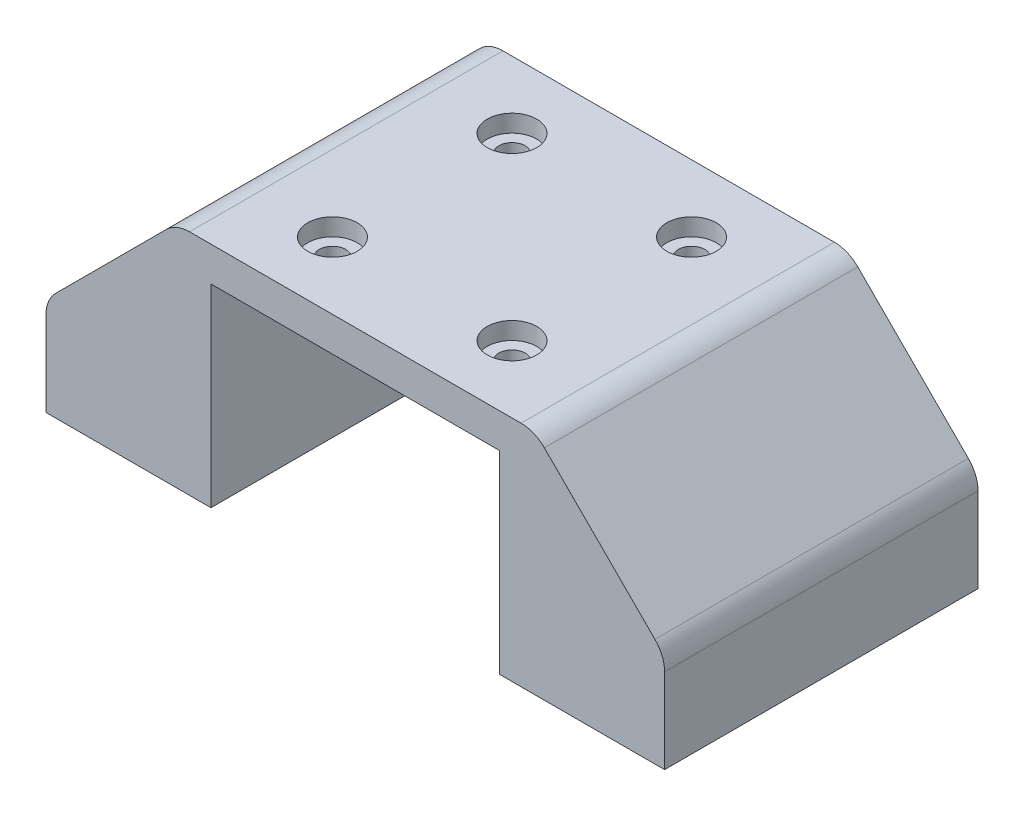
from build123d import *

# Parameters (mm, degrees)
BOSS_EXTRUDE1_DEPTH = 24.13
CHAMFER1_SIZE       = 10
FILLET1_R           = 2.54
FILLET2_R           = 2.54
SKETCH2_R           = 2.032
CUT_EXTRUDE1_DEPTH  = 10.16
SKETCH3_R           = 1.016
CUT_EXTRUDE2_DEPTH  = 39.185845946
SKETCH4_R           = 1.905
CUT_EXTRUDE3_DEPTH  = 1.3335


with BuildPart() as part:
    # Sketch1 → Boss-Extrude1 (new body)
    with BuildSketch(Plane.XY):
        Polygon((-11.1125, 0), (-11.1125, 14.9225), (11.1125, 14.9225), (11.1125, 0), (23.8125, 0), (23.8125, 17.574605951), (-23.8125, 17.574605951), (-23.8125, 0), align=None)
    extrude(amount=BOSS_EXTRUDE1_DEPTH)

    # Chamfer1
    chamfer1_edges = [part.edges().sort_by_distance(p)[0] for p in [
        (23.8125, 17.574605951, 12.065),
        (-23.8125, 17.574605951, 12.065),
    ]]
    chamfer(chamfer1_edges, length=CHAMFER1_SIZE)

    # Fillet1
    fillet1_edges = [part.edges().sort_by_distance(p)[0] for p in [
        (13.8125, 17.574605951, 12.065),
        (-13.8125, 17.574605951, 12.065),
    ]]
    fillet(fillet1_edges, radius=FILLET1_R)

    # Fillet2
    fillet2_edges = [part.edges().sort_by_distance(p)[0] for p in [
        (23.8125, 7.574605951, 12.065),
        (-23.8125, 7.574605951, 12.065),
    ]]
    fillet(fillet2_edges, radius=FILLET2_R)

    # Sketch2 → Cut-Extrude1 (cut)
    with BuildSketch(Plane.XZ):
        with Locations((-19.05, 19.685)):
            Circle(SKETCH2_R)
        with Locations((19.05, 19.685)):
            Circle(SKETCH2_R)
        with Locations((19.05, 4.445)):
            Circle(SKETCH2_R)
        with Locations((-19.05, 4.445)):
            Circle(SKETCH2_R)
    extrude(amount=-CUT_EXTRUDE1_DEPTH, mode=Mode.SUBTRACT)

    # Sketch3 → Cut-Extrude2 (cut, through all)
    with BuildSketch(Plane(origin=(0, 17.574605951, 0), x_dir=(1, 0, 0), z_dir=(0, 1, 0))):
        with Locations((-6.91134, -5.15366)):
            Circle(SKETCH3_R)
        with Locations((6.91134, -5.15366)):
            Circle(SKETCH3_R)
        with Locations((6.91134, -18.97634)):
            Circle(SKETCH3_R)
        with Locations((-6.91134, -18.97634)):
            Circle(SKETCH3_R)
    extrude(amount=-CUT_EXTRUDE2_DEPTH, mode=Mode.SUBTRACT)

    # Sketch4 → Cut-Extrude3 (cut)
    with BuildSketch(Plane(origin=(0, 17.574605951, 0), x_dir=(1, 0, 0), z_dir=(0, 1, 0))):
        with Locations((-6.91134, -5.15366)):
            Circle(SKETCH4_R)
        with Locations((6.91134, -5.15366)):
            Circle(SKETCH4_R)
        with Locations((6.91134, -18.97634)):
            Circle(SKETCH4_R)
        with Locations((-6.91134, -18.97634)):
            Circle(SKETCH4_R)
    extrude(amount=-CUT_EXTRUDE3_DEPTH, mode=Mode.SUBTRACT)


solid = part.part
